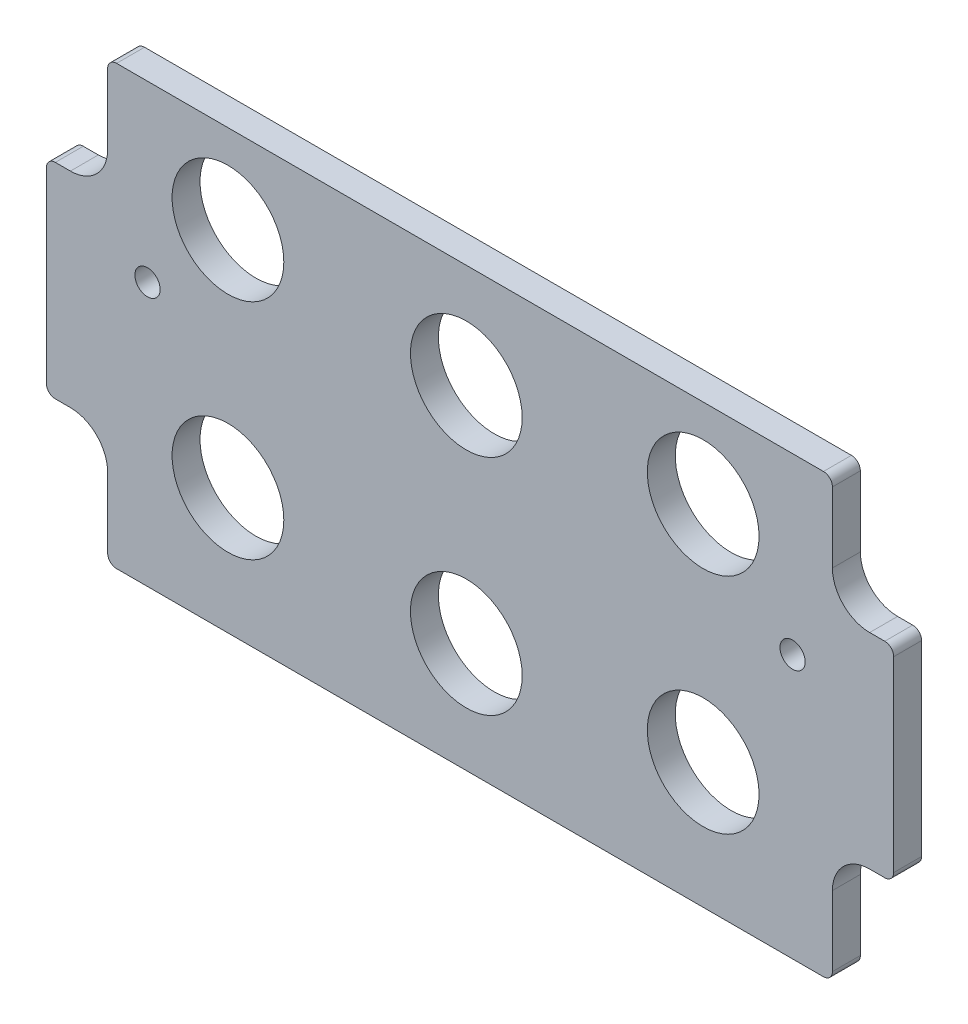
from build123d import *

# Parameters (mm, degrees)
BOSS_EXTRUDE1_DEPTH         = 4.7625
F_3_4_0_75_DIAMETER_HOLE1_D = 19.05
F_6_CLEARANCE_HOLE1_D       = 4.3053


with BuildPart() as part:
    # Sketch1 → Boss-Extrude1 (new body)
    with BuildSketch(Plane.XY):
        with BuildLine():
            Line((134.8105, 61.9125), (134.8105, 73.88225))
            ThreePointArc((134.8105, 73.88225), (134.364130735, 74.959880735), (133.2865, 75.40625))
            Line((133.2865, 75.40625), (12.7635, 75.40625))
            ThreePointArc((12.7635, 75.40625), (11.685869265, 74.959880735), (11.2395, 73.88225))
            Line((11.2395, 73.88225), (11.2395, 61.9125))
            ThreePointArc((11.2395, 61.9125), (9.379628061, 57.422371939), (4.8895, 55.5625))
            Line((4.8895, 55.5625), (2.31775, 55.5625))
            ThreePointArc((2.31775, 55.5625), (1.240119265, 55.116130735), (0.79375, 54.0385))
            Line((0.79375, 54.0385), (0.79375, 22.1615))
            ThreePointArc((0.79375, 22.1615), (1.240119265, 21.083869265), (2.31775, 20.6375))
            Line((2.31775, 20.6375), (4.8895, 20.6375))
            ThreePointArc((4.8895, 20.6375), (9.379628061, 18.777628061), (11.2395, 14.2875))
            Line((11.2395, 14.2875), (11.2395, 2.31775))
            ThreePointArc((11.2395, 2.31775), (11.685869265, 1.240119265), (12.7635, 0.79375))
            Line((12.7635, 0.79375), (133.2865, 0.79375))
            ThreePointArc((133.2865, 0.79375), (134.364130735, 1.240119265), (134.8105, 2.31775))
            Line((134.8105, 2.31775), (134.8105, 14.2875))
            ThreePointArc((134.8105, 14.2875), (136.670371939, 18.777628061), (141.1605, 20.6375))
            Line((141.1605, 20.6375), (143.73225, 20.6375))
            ThreePointArc((143.73225, 20.6375), (144.809880735, 21.083869265), (145.25625, 22.1615))
            Line((145.25625, 22.1615), (145.25625, 54.0385))
            ThreePointArc((145.25625, 54.0385), (144.809880735, 55.116130735), (143.73225, 55.5625))
            Line((143.73225, 55.5625), (141.1605, 55.5625))
            ThreePointArc((141.1605, 55.5625), (136.670371939, 57.422371939), (134.8105, 61.9125))
        make_face()
    extrude(amount=BOSS_EXTRUDE1_DEPTH)

    # 3/4 (0.75) Diameter Hole1 (through all)
    with Locations(Plane.XY.offset(4.7625)):
        with Locations((31.75, 60.325), (72.39, 57.658), (112.776, 60.325), (112.776, 22.225), (31.75, 22.225), (72.39, 19.558)):
            Hole(F_3_4_0_75_DIAMETER_HOLE1_D / 2)

    # #6 Clearance Hole1 (through all)
    with Locations(Plane.XY.offset(4.7625)):
        with Locations((18.034, 45.72), (128.016, 45.72)):
            Hole(F_6_CLEARANCE_HOLE1_D / 2)


solid = part.part
